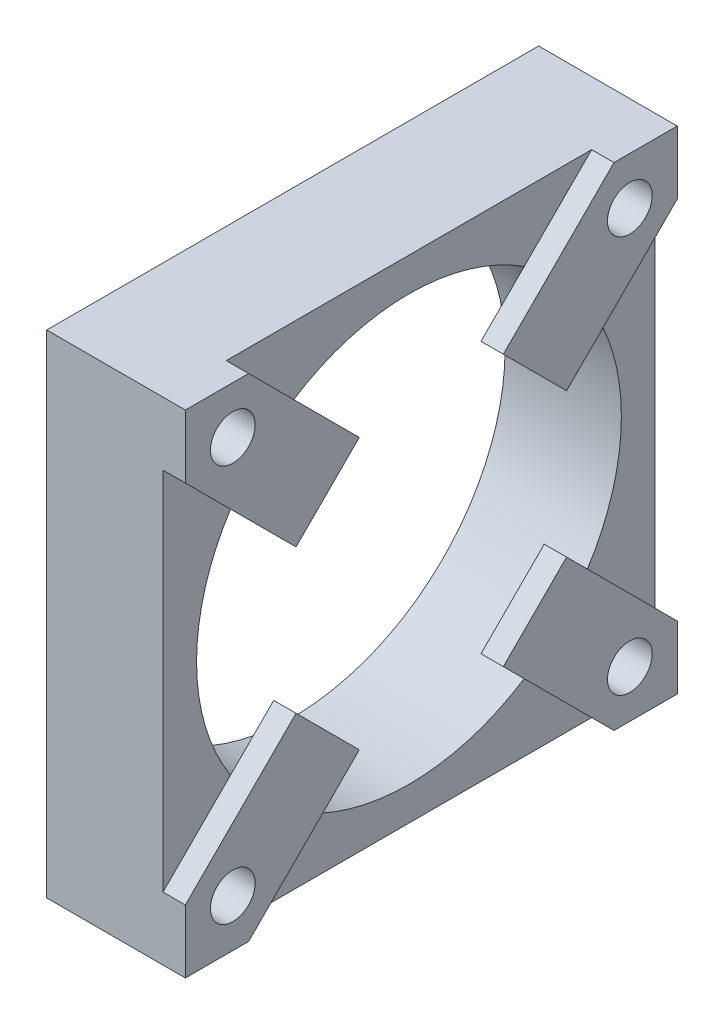
from build123d import *

# Parameters (mm, degrees)
SKETCH1_W               = 55.88
SKETCH1_H               = 55.88
SKETCH1_R               = 24.13
BOSS_EXTRUDE1_DEPTH     = 13.208
BOSS_EXTRUDE2_DEPTH     = 2.54
CIRPATTERN1_COUNT       = 4
CUT_EXTRUDE2_DEPTH      = 43.535710926
CUT_EXTRUDE2_DEPTH_BACK = 43.535710926
SKETCH5_R               = 2.54


with BuildPart() as part:
    # Sketch1 → Boss-Extrude1 (new body)
    with BuildSketch(Plane(origin=(0, 0, 0), x_dir=(0, 0, -1), z_dir=(1, 0, 0))):
        Rectangle(SKETCH1_W, SKETCH1_H)
        Circle(SKETCH1_R, mode=Mode.SUBTRACT)
    extrude(amount=BOSS_EXTRUDE1_DEPTH)

    # Sketch2 → Boss-Extrude2 (add)
    with BuildSketch(Plane(origin=(13.208, 0, 0), x_dir=(0, 0, -1), z_dir=(1, 0, 0))):
        Polygon((-27.94, 20.755795103), (-27.94, 27.94), (-20.755795103, 27.94), (-8.183436534, 15.367641431), (-15.367641431, 8.183436534), align=None)
    boss_extrude2 = extrude(amount=BOSS_EXTRUDE2_DEPTH)

    # CirPattern1: Boss-Extrude2 ×4 about axis
    cirpattern1_axis = Axis((13.208, 0, 0), (1, 0, 0))
    for i in range(1, CIRPATTERN1_COUNT):
        add(boss_extrude2.rotate(cirpattern1_axis, i * 360 / CIRPATTERN1_COUNT))

    # Sketch5 → Cut-Extrude2 (cut, two sides: drawn at the far end of the back side and taken through both)
    with BuildSketch(Plane(origin=(0, 0, 0), x_dir=(0, 0, -1), z_dir=(1, 0, 0)).offset(-CUT_EXTRUDE2_DEPTH_BACK)):
        with Locations((-22.551846327, -22.551846327)):
            Circle(SKETCH5_R)
        with Locations((-22.551846327, 22.551846327)):
            Circle(SKETCH5_R)
        with Locations((22.551846327, 22.551846327)):
            Circle(SKETCH5_R)
        with Locations((22.551846327, -22.551846327)):
            Circle(SKETCH5_R)
    extrude(amount=CUT_EXTRUDE2_DEPTH + CUT_EXTRUDE2_DEPTH_BACK, mode=Mode.SUBTRACT)


solid = part.part
